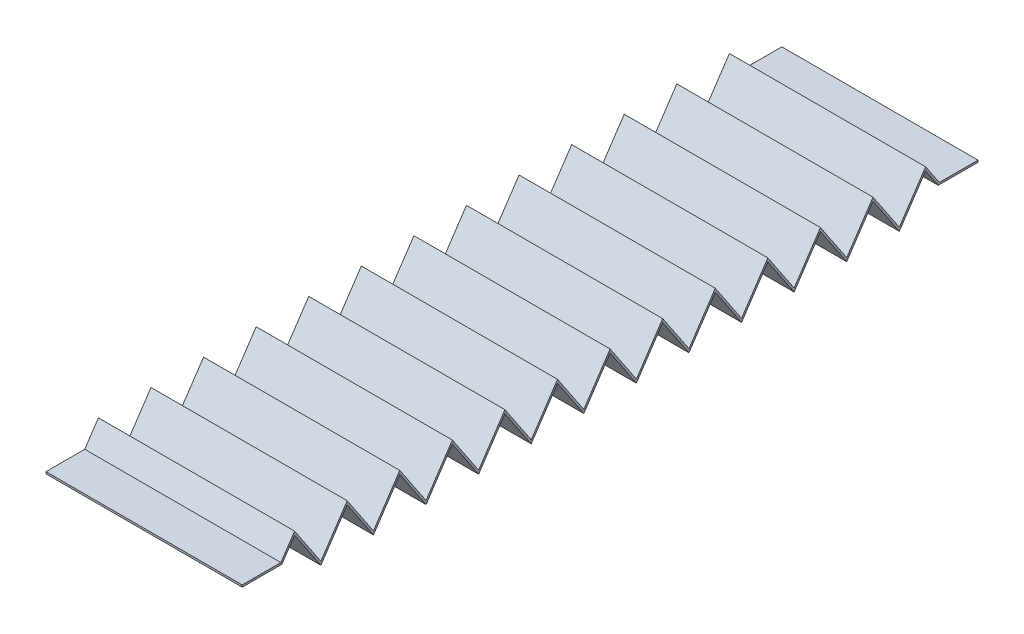
from build123d import *

# Parameters (mm, degrees)
EXTRUDE_THIN1_DEPTH = 25


with BuildPart() as part:
    # Sketch3 → Extrude-Thin1 (new, symmetric)
    with BuildSketch(Plane(origin=(0, 0, 0), x_dir=(0, 0, -1), z_dir=(1, 0, 0))):
        Polygon((0, 4.75), (10.133425388, 4.75), (13.350012062, 9.550858347), (20.050036186, -0.449141653), (26.750060309, 9.550858347), (33.450084433, -0.449141653), (40.150108557, 9.550858347), (46.85013268, -0.449141653), (53.550156804, 9.550858347), (60.250180928, -0.449141653), (66.950205051, 9.550858347), (73.650229175, -0.449141653), (80.350253299, 9.550858347), (87.050277423, -0.449141653), (93.750301546, 9.550858347), (100.45032567, -0.449141653), (107.150349794, 9.550858347), (113.850373917, -0.449141653), (120.550398041, 9.550858347), (127.250422165, -0.449141653), (133.950446288, 9.550858347), (140.650470412, -0.449141653), (147.350494536, 9.550858347), (154.05051866, -0.449141653), (160.750542783, 9.550858347), (167.450566907, -0.449141653), (174.150591031, 9.550858347), (177.367177705, 4.75), (187.500603092, 4.75), (187.500603092, 5.25), (177.63402848, 5.25), (174.150591031, 10.449141653), (167.450566907, 0.449141653), (160.750542783, 10.449141653), (154.05051866, 0.449141653), (147.350494536, 10.449141653), (140.650470412, 0.449141653), (133.950446288, 10.449141653), (127.250422165, 0.449141653), (120.550398041, 10.449141653), (113.850373917, 0.449141653), (107.150349794, 10.449141653), (100.45032567, 0.449141653), (93.750301546, 10.449141653), (87.050277423, 0.449141653), (80.350253299, 10.449141653), (73.650229175, 0.449141653), (66.950205051, 10.449141653), (60.250180928, 0.449141653), (53.550156804, 10.449141653), (46.85013268, 0.449141653), (40.150108557, 10.449141653), (33.450084433, 0.449141653), (26.750060309, 10.449141653), (20.050036186, 0.449141653), (13.350012062, 10.449141653), (9.866574612, 5.25), (0, 5.25), align=None)
    extrude(amount=EXTRUDE_THIN1_DEPTH, both=True)


solid = part.part
